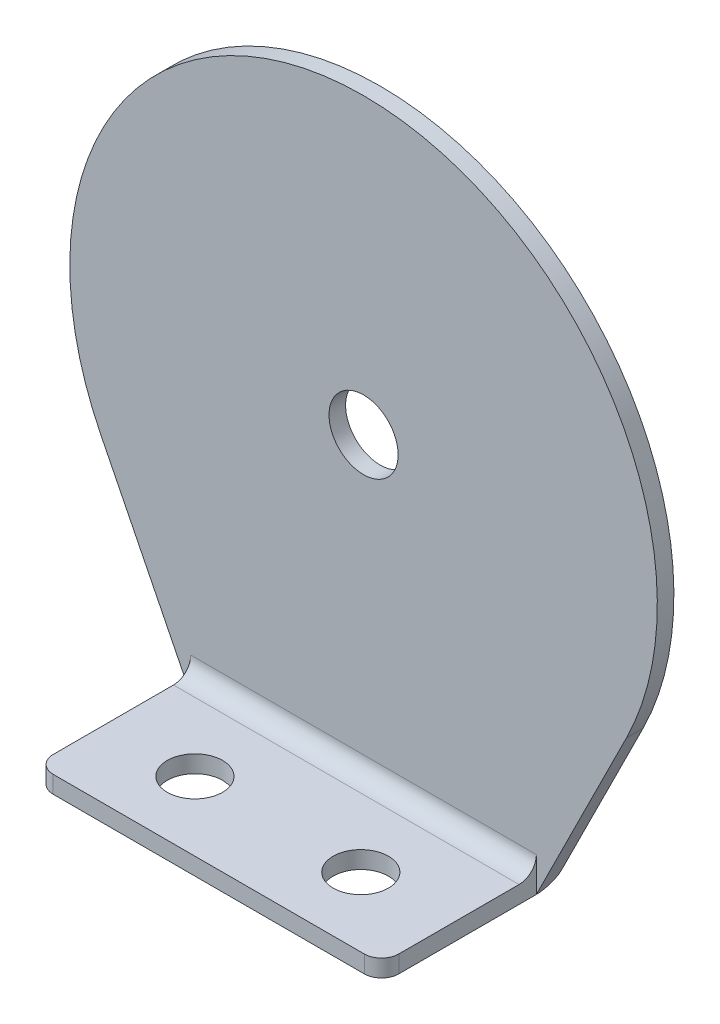
from build123d import *

# Parameters (mm, degrees)
BOSS_EXTRUDE1_DEPTH = 1.524
SKETCH2_R           = 3.175
CUT_EXTRUDE1_DEPTH  = 62.84577276
SKETCH3_W           = 31.75
SKETCH3_H           = 1.5875
BOSS_EXTRUDE2_DEPTH = 14.224
FILLET1_R           = 1.5875
SKETCH4_R           = 2.54
CUT_EXTRUDE2_DEPTH  = 64.801070024


with BuildPart() as part:
    # Sketch1 → Boss-Extrude1 (new body)
    with BuildSketch(Plane.XY):
        with BuildLine():
            Line((-24.150754652, 16.594156681), (-15.875, 0))
            Line((-15.875, 0), (15.875, 0))
            Line((15.875, 0), (24.150754652, 16.594156681))
            ThreePointArc((24.150754652, 16.594156681), (0, 55.626), (-24.150754652, 16.594156681))
        make_face()
    extrude(amount=BOSS_EXTRUDE1_DEPTH)

    # Sketch2 → Cut-Extrude1 (cut, through all)
    with BuildSketch(Plane.XY.offset(1.524)):
        with Locations((0, 28.6385)):
            Circle(SKETCH2_R)
    extrude(amount=-CUT_EXTRUDE1_DEPTH, mode=Mode.SUBTRACT)

    # Sketch3 → Boss-Extrude2 (add)
    with BuildSketch(Plane.XY.offset(1.524)):
        with Locations((0, 0.79375)):
            Rectangle(SKETCH3_W, SKETCH3_H)
    extrude(amount=BOSS_EXTRUDE2_DEPTH)

    # Fillet1
    # the kernel refuses this fillet: 1.5875 mm, written as the material it adds along each edge
    with BuildSketch(Plane(origin=(15.875, 1.5875, 1.524), x_dir=(0, 1, 0), z_dir=(-1, 0, 0))) as fillet1_piece_1:
        with BuildLine():
            CenterArc((FILLET1_R, -FILLET1_R), FILLET1_R, 90, 90)
            Line((0, -FILLET1_R), (0, 0))
            Line((0, 0), (FILLET1_R, 0))
        make_face()
    extrude(amount=31.75)
    # the kernel refuses this fillet: 1.5875 mm, written as the material it takes off along each edge
    with BuildSketch(Plane(origin=(-15.875, 5.55625, 15.748), x_dir=(1, 0, 0), z_dir=(0, -1, 0))) as fillet1_2_piece_1:
        with BuildLine():
            CenterArc((FILLET1_R, -FILLET1_R), FILLET1_R, 90, 90)
            Line((0, -FILLET1_R), (0, 0))
            Line((0, 0), (FILLET1_R, 0))
        make_face()
    extrude(amount=9.525, mode=Mode.SUBTRACT)
    with BuildSketch(Plane(origin=(15.875, -3.96875, 15.748), x_dir=(0, 0, -1), z_dir=(0, 1, 0))) as fillet1_2_piece_2:
        with BuildLine():
            CenterArc((FILLET1_R, FILLET1_R), FILLET1_R, 180, 90)
            Line((0, FILLET1_R), (0, 0))
            Line((0, 0), (FILLET1_R, 0))
        make_face()
    extrude(amount=9.525, mode=Mode.SUBTRACT)
    with BuildSketch(Plane(origin=(-19.84375, 0, 0), x_dir=(0, 1, 0), z_dir=(1, 0, 0))) as fillet1_2_piece_3:
        with BuildLine():
            CenterArc((FILLET1_R, FILLET1_R), FILLET1_R, 180, 90)
            Line((0, FILLET1_R), (0, 0))
            Line((0, 0), (FILLET1_R, 0))
        make_face()
    extrude(amount=39.6875, mode=Mode.SUBTRACT)

    # Sketch4 → Cut-Extrude2 (cut, through all)
    with BuildSketch(Plane.XZ):
        with Locations(Location((7.62, 9.398, 0), (0, 0, 270))):
            Circle(SKETCH4_R)
        with Locations(Location((-7.62, 9.398, 0), (0, 0, 270))):
            Circle(SKETCH4_R)
    extrude(amount=-CUT_EXTRUDE2_DEPTH, mode=Mode.SUBTRACT)


solid = part.part
